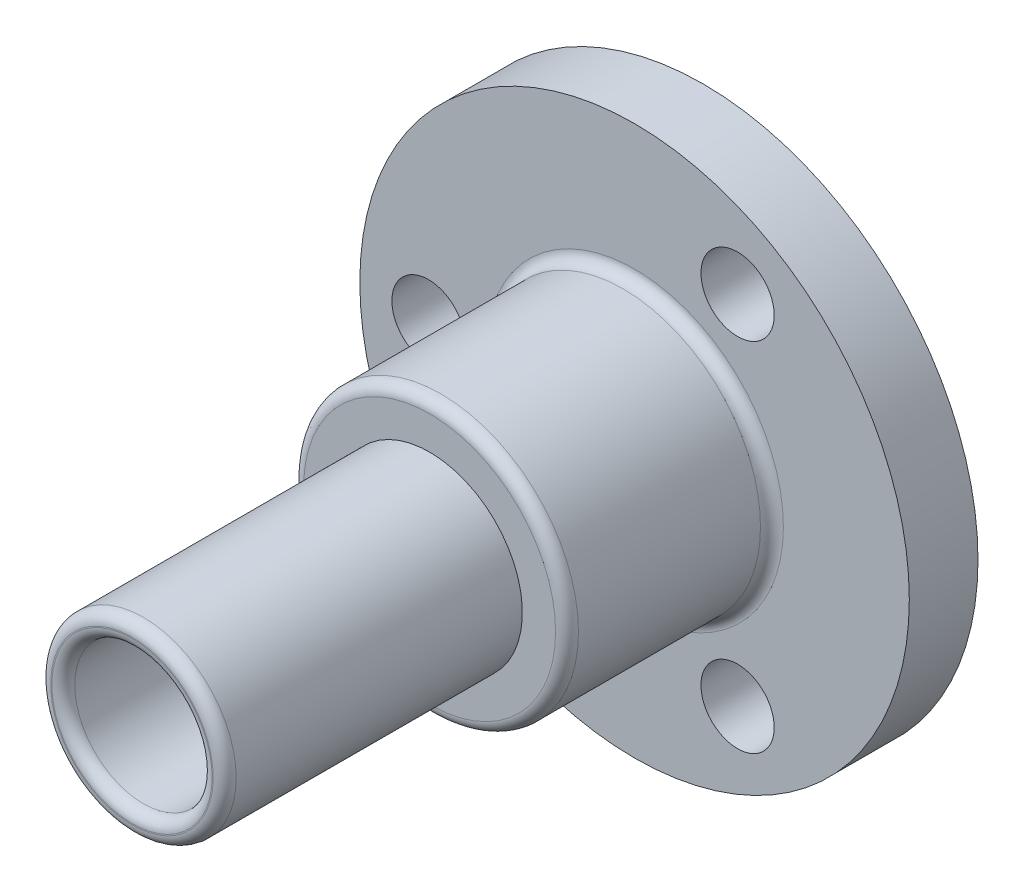
from build123d import *

# Parameters (mm, degrees)
CROQUIS1_R              = 12
CROQUIS1_R_2            = 1.6
CROQUIS1_R_3            = 4.5
SALIENTE_EXTRUIR1_DEPTH = 3
CROQUIS2_R              = 6
CROQUIS2_R_2            = 3
SALIENTE_EXTRUIR2_DEPTH = 8.95
CROQUIS3_R              = 4.05
CROQUIS3_R_2            = 3
SALIENTE_EXTRUIR3_DEPTH = 13
REDONDEO1_R             = 0.5


with BuildPart() as part:
    # Croquis1 → Saliente-Extruir1 (new body)
    with BuildSketch(Plane(origin=(0, 0, 0), x_dir=(0, 1, 0), z_dir=(0, 0, 1))):
        Circle(CROQUIS1_R)
        with Locations((0, 9)):
            Circle(CROQUIS1_R_2, mode=Mode.SUBTRACT)
        with Locations((7.794228634, -4.5)):
            Circle(CROQUIS1_R_2, mode=Mode.SUBTRACT)
        with Locations((-7.794228634, -4.5)):
            Circle(CROQUIS1_R_2, mode=Mode.SUBTRACT)
        Circle(CROQUIS1_R_3, mode=Mode.SUBTRACT)
    extrude(amount=SALIENTE_EXTRUIR1_DEPTH)

    # Croquis2 → Saliente-Extruir2 (add)
    with BuildSketch(Plane.XY.offset(3)):
        Circle(CROQUIS2_R)
        Circle(CROQUIS2_R_2, mode=Mode.SUBTRACT)
    extrude(amount=SALIENTE_EXTRUIR2_DEPTH)

    # Croquis3 → Saliente-Extruir3 (add)
    with BuildSketch(Plane.XY.offset(11.95)):
        Circle(CROQUIS3_R)
        Circle(CROQUIS3_R_2, mode=Mode.SUBTRACT)
    extrude(amount=SALIENTE_EXTRUIR3_DEPTH)

    # Redondeo1
    redondeo1_edges = [part.edges().sort_by_distance(p)[0] for p in [
        (-3, 0, 24.95),
        (-4.05, 0, 24.95),
        (-6, 0, 11.95),
        (-6, 0, 3),
    ]]
    fillet(redondeo1_edges, radius=REDONDEO1_R)


solid = part.part
